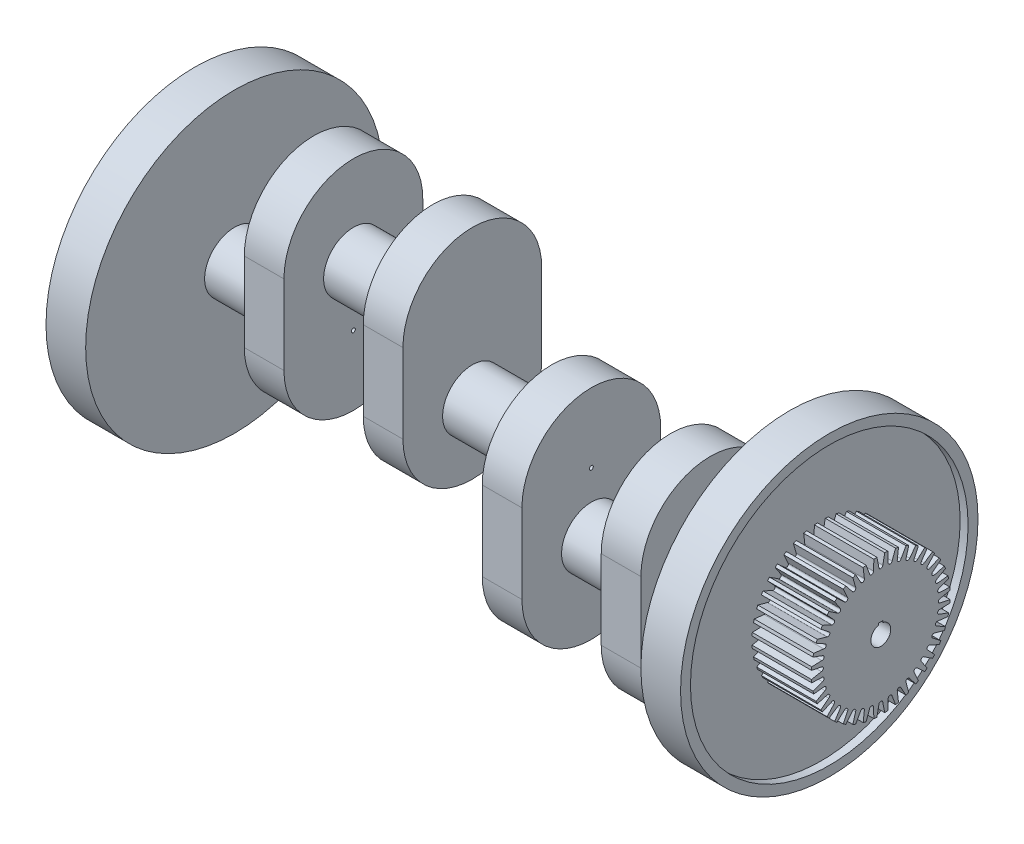
from build123d import *

# Parameters (mm, degrees)
SKETCH1_R            = 37.5
BOSS_EXTRUDE1_DEPTH  = 10
BOSS_EXTRUDE2_START  = 10
SKETCH3_R            = 7.5
BOSS_EXTRUDE2_DEPTH  = 20
BOSS_EXTRUDE3_START  = 20
BOSS_EXTRUDE3_DEPTH  = 10
BOSS_EXTRUDE5_START  = 20
BOSS_EXTRUDE5_DEPTH  = 10
BOSS_EXTRUDE6_START  = 20
BOSS_EXTRUDE6_DEPTH  = 10
BOSS_EXTRUDE7_START  = 20
BOSS_EXTRUDE7_DEPTH  = 10
BOSS_EXTRUDE13_REACH = 89.821
SKETCH14_R           = 7.5
SKETCH15_R           = 7.5
BOSS_EXTRUDE14_DEPTH = 20
SKETCH16_R           = 37.5
BOSS_EXTRUDE15_DEPTH = 10
BOSS_EXTRUDE16_REACH = 115.192
SKETCH12_R           = 7.5
BOSS_EXTRUDE17_REACH = 133.196
SKETCH11_R           = 7.5
SKETCH21_R           = 35
CUT_EXTRUDE3_DEPTH   = 2
SKETCH22_R           = 35
CUT_EXTRUDE4_DEPTH   = 2
SKETCH23_R           = 17.5
BOSS_EXTRUDE18_DEPTH = 15
SKETCH24_R           = 0.5
CUT_EXTRUDE5_DEPTH   = 180.034912796
SKETCH27_R           = 2.5
CUT_EXTRUDE6_DEPTH   = 53
SKETCH32_W           = 1.17994976
SKETCH32_H           = 0.75
CUT_EXTRUDE9_DEPTH   = 132.196417634
CUT_EXTRUDE11_DEPTH  = 15
CIRPATTERN1_COUNT    = 40
SKETCH34_R           = 5
SKETCH34_R_2         = 3.75
BOSS_EXTRUDE19_DEPTH = 2
CUT_EXTRUDE13_DEPTH  = 2
CIRPATTERN2_DEPTH    = 2


# Read off the part's stored shape, not the designer's step: CirPattern2
with BuildPart() as part:
    # Sketch1 → Boss-Extrude1 (new body)
    with BuildSketch(Plane(origin=(0, 0, 0), x_dir=(0, 0, -1), z_dir=(1, 0, 0))):
        Circle(SKETCH1_R)
    extrude(amount=BOSS_EXTRUDE1_DEPTH)

    # Sketch3 → Boss-Extrude2 (add)
    with BuildSketch(Plane(origin=(0, 0, 0), x_dir=(0, 0, -1), z_dir=(1, 0, 0)).offset(BOSS_EXTRUDE2_START)):
        Circle(SKETCH3_R)
    extrude(amount=BOSS_EXTRUDE2_DEPTH)

    # Sketch4 → Boss-Extrude3 (add)
    with BuildSketch(Plane(origin=(10, 0, 0), x_dir=(0, 0, -1), z_dir=(1, 0, 0)).offset(BOSS_EXTRUDE3_START)):
        with BuildLine():
            Line((-17.5, 0), (-17.5, 20))
            ThreePointArc((-17.5, 20), (0, 37.5), (17.5, 20))
            Line((17.5, 20), (17.5, 0))
            ThreePointArc((17.5, 0), (0, -17.5), (-17.5, 0))
        make_face()
    extrude(amount=BOSS_EXTRUDE3_DEPTH)


with BuildPart() as body_2:
    # Sketch7 → Boss-Extrude5 (new body)
    with BuildSketch(Plane(origin=(40, 0, 0), x_dir=(0, 0, -1), z_dir=(1, 0, 0)).offset(BOSS_EXTRUDE5_START)):
        with BuildLine():
            Line((-17.5, 0), (-17.5, 20))
            ThreePointArc((-17.5, 20), (0, 37.5), (17.5, 20))
            Line((17.5, 20), (17.5, 0))
            ThreePointArc((17.5, 0), (0, -17.5), (-17.5, 0))
        make_face()
    extrude(amount=BOSS_EXTRUDE5_DEPTH)


with BuildPart() as body_3:
    # Sketch8 → Boss-Extrude6 (new body)
    with BuildSketch(Plane(origin=(70, 0, 0), x_dir=(0, 0, -1), z_dir=(1, 0, 0)).offset(BOSS_EXTRUDE6_START)):
        with BuildLine():
            Line((17.5, 0), (17.5, -20))
            ThreePointArc((17.5, -20), (0, -37.5), (-17.5, -20))
            Line((-17.5, -20), (-17.5, 0))
            ThreePointArc((-17.5, 0), (0, 17.5), (17.5, 0))
        make_face()
    extrude(amount=BOSS_EXTRUDE6_DEPTH)

    # Sketch14 → Boss-Extrude13 (add, up to next)
    with BuildSketch(Plane(origin=(70, 0, 0), x_dir=(0, 0, -1), z_dir=(1, 0, 0)), mode=Mode.PRIVATE) as boss_extrude13_sk1:
        Circle(SKETCH14_R)
    boss_extrude13_tool1 = extrude(boss_extrude13_sk1.sketch, amount=BOSS_EXTRUDE13_REACH, mode=Mode.PRIVATE) - body_3.part

    add(body_2.part)  # Boss-Extrude13 merges body 2
    add(boss_extrude13_tool1.solids().sort_by_distance((70, 0, 0))[0])


with BuildPart() as body_4:
    # Sketch9 → Boss-Extrude7 (new body)
    with BuildSketch(Plane(origin=(100, 0, 0), x_dir=(0, 0, -1), z_dir=(1, 0, 0)).offset(BOSS_EXTRUDE7_START)):
        with BuildLine():
            Line((17.5, 0), (17.5, -20))
            ThreePointArc((17.5, -20), (0, -37.5), (-17.5, -20))
            Line((-17.5, -20), (-17.5, 0))
            ThreePointArc((-17.5, 0), (0, 17.5), (17.5, 0))
        make_face()
    extrude(amount=BOSS_EXTRUDE7_DEPTH)

    # Sketch15 → Boss-Extrude14 (add)
    with BuildSketch(Plane(origin=(130, 0, 0), x_dir=(0, 0, -1), z_dir=(1, 0, 0))):
        Circle(SKETCH15_R)
    extrude(amount=BOSS_EXTRUDE14_DEPTH)

    # Sketch16 → Boss-Extrude15 (add)
    with BuildSketch(Plane(origin=(150, 0, 0), x_dir=(0, 0, -1), z_dir=(1, 0, 0))):
        Circle(SKETCH16_R)
    extrude(amount=BOSS_EXTRUDE15_DEPTH)

    # Sketch12 → Boss-Extrude16 (add, up to next)
    with BuildSketch(Plane(origin=(100, 0, 0), x_dir=(0, 0, -1), z_dir=(1, 0, 0)), mode=Mode.PRIVATE) as boss_extrude16_sk1:
        with Locations((0, -15)):
            Circle(SKETCH12_R)
    boss_extrude16_tool1 = extrude(boss_extrude16_sk1.sketch, amount=BOSS_EXTRUDE16_REACH, mode=Mode.PRIVATE) - body_4.part

    add(body_3.part)  # Boss-Extrude16 merges body 3
    add(boss_extrude16_tool1.solids().sort_by_distance((100, -15, 0))[0])

    # Sketch11 → Boss-Extrude17 (add, up to next)
    with BuildSketch(Plane(origin=(40, 0, 0), x_dir=(0, 0, -1), z_dir=(1, 0, 0)), mode=Mode.PRIVATE) as boss_extrude17_sk1:
        with Locations((0, 15)):
            Circle(SKETCH11_R)
    boss_extrude17_tool1 = extrude(boss_extrude17_sk1.sketch, amount=BOSS_EXTRUDE17_REACH, mode=Mode.PRIVATE) - body_4.part

    add(part.part)  # Boss-Extrude17 merges part
    add(boss_extrude17_tool1.solids().sort_by_distance((40, 15, 0))[0])

    # Sketch21 → Cut-Extrude3 (cut)
    with BuildSketch(Plane(origin=(160, 0, 0), x_dir=(0, 0, -1), z_dir=(1, 0, 0))):
        Circle(SKETCH21_R)
    extrude(amount=-CUT_EXTRUDE3_DEPTH, mode=Mode.SUBTRACT)

    # Sketch22 → Cut-Extrude4 (cut)
    with BuildSketch(Plane.ZY):
        with Locations(Location((0, 0, 0), (0, 0, 180))):
            Circle(SKETCH22_R)
    extrude(amount=-CUT_EXTRUDE4_DEPTH, mode=Mode.SUBTRACT)

    # Sketch23 → Boss-Extrude18 (add)
    with BuildSketch(Plane(origin=(158, 0, 0), x_dir=(0, 0, -1), z_dir=(1, 0, 0))):
        Circle(SKETCH23_R)
    extrude(amount=BOSS_EXTRUDE18_DEPTH)

    # Sketch24 → Cut-Extrude5 (cut, through all)
    with BuildSketch(Plane.ZY.offset(-2)):
        Circle(SKETCH24_R)
    extrude(amount=-CUT_EXTRUDE5_DEPTH, mode=Mode.SUBTRACT)

    # Sketch27 → Cut-Extrude6 (cut)
    with BuildSketch(Plane(origin=(173, 0, 0), x_dir=(0, 0, -1), z_dir=(1, 0, 0))):
        Circle(SKETCH27_R)
    extrude(amount=-CUT_EXTRUDE6_DEPTH, mode=Mode.SUBTRACT)

    # Sketch32 → Cut-Extrude9 (cut, through all)
    with BuildSketch(Plane.ZY.offset(-120)):
        with Locations((0, 2.5)):
            Rectangle(SKETCH32_W, SKETCH32_H)
    extrude(amount=-CUT_EXTRUDE9_DEPTH, mode=Mode.SUBTRACT)

    # Sketch33 → Cut-Extrude11 (cut)
    with BuildSketch(Plane(origin=(173, 0, 0), x_dir=(0, 0, -1), z_dir=(1, 0, 0))):
        with BuildLine():
            Line((1, 17.5), (0.498038073, 15))
            ThreePointArc((0.498038073, 15), (0, 14.501961927), (-0.498038073, 15))
            Line((-0.498038073, 15), (-1, 17.5))
            ThreePointArc((-1, 17.5), (0, 18.5), (1, 17.5))
        make_face()
    cut_extrude11 = extrude(amount=-CUT_EXTRUDE11_DEPTH, mode=Mode.SUBTRACT)

    # CirPattern1: Cut-Extrude11 ×40 about axis
    cirpattern1_axis = Axis((0, 0, 0), (1, 0, 0))
    for i in range(1, CIRPATTERN1_COUNT):
        add(cut_extrude11.rotate(cirpattern1_axis, i * 360 / CIRPATTERN1_COUNT), mode=Mode.SUBTRACT)

    # Sketch34 → Boss-Extrude19 (add)
    with BuildSketch(Plane.ZY.offset(-2)):
        Circle(SKETCH34_R)
        Circle(SKETCH34_R_2, mode=Mode.SUBTRACT)
    extrude(amount=BOSS_EXTRUDE19_DEPTH)

    # Sketch35 → Cut-Extrude13 (cut)
    with BuildSketch(Plane.ZY):
        Polygon((-0.075, 4.375), (0.075, 4.375), (0.2, 3.549214862), (-0.2, 3.549214862), align=None)
    extrude(amount=-CUT_EXTRUDE13_DEPTH, mode=Mode.SUBTRACT)

    # CirPattern2 outline → CirPattern2 (cut)
    with BuildSketch(Plane.YZ):
        with BuildLine():
            Line((4.327781804, -0.645410456), (4.347360733, -0.496693726))
            Line((4.347360733, -0.496693726), (3.736301754, -0.320233043))
            ThreePointArc((3.736301754, -0.320233043), (3.71791823, -0.48947322), (3.691872769, -0.657704685))
            Line((3.691872769, -0.657704685), (4.327781804, -0.645410456))
        make_face()
        with BuildLine():
            Line((4.327781804, 0.645410456), (3.691872769, 0.657704685))
            ThreePointArc((3.691872769, 0.657704685), (3.71791823, 0.48947322), (3.736301754, 0.320233043))
            Line((3.736301754, 0.320233043), (4.347360733, 0.496693726))
            Line((4.347360733, 0.496693726), (4.327781804, 0.645410456))
        make_face()
        with BuildLine():
            Line((4.206514062, 1.204777759), (3.574440598, 1.133964025))
            ThreePointArc((3.574440598, 1.133964025), (3.622221848, 0.970571419), (3.662538375, 0.805178646))
            Line((3.662538375, 0.805178646), (4.245336918, 1.059888885))
            Line((4.245336918, 1.059888885), (4.206514062, 1.204777759))
        make_face()
        with BuildLine():
            Line((4.013271697, 1.743530982), (3.395848757, 1.590820926))
            ThreePointArc((3.395848757, 1.590820926), (3.464548247, 1.435062871), (3.526107948, 1.276347419))
            Line((3.526107948, 1.276347419), (4.070674212, 1.604949052))
            Line((4.070674212, 1.604949052), (4.013271697, 1.743530982))
        make_face()
        with BuildLine():
            Line((3.751361142, 2.252451905), (3.159153001, 2.020458441))
            ThreePointArc((3.159153001, 2.020458441), (3.247595264, 1.875), (3.329344837, 1.725677534))
            Line((3.329344837, 1.725677534), (3.826361142, 2.122548095))
            Line((3.826361142, 2.122548095), (3.751361142, 2.252451905))
        make_face()
        with BuildLine():
            Line((3.425263757, 2.722832752), (2.868403263, 2.41552535))
            ThreePointArc((2.868403263, 2.41552535), (2.975075026, 2.282855359), (3.075615713, 2.145480828))
            Line((3.075615713, 2.145480828), (3.516577971, 2.603829751))
            Line((3.516577971, 2.603829751), (3.425263757, 2.722832752))
        make_face()
        with BuildLine():
            Line((3.040559159, 3.146625176), (2.52857435, 2.769261952))
            ThreePointArc((2.52857435, 2.769261952), (2.651650429, 2.651650429), (2.769261951, 2.52857435))
            Line((2.769261951, 2.52857435), (3.146625176, 3.040559159))
            Line((3.146625176, 3.040559159), (3.040559159, 3.146625176))
        make_face()
        with BuildLine():
            Line((2.603829751, 3.516577971), (2.145480828, 3.075615713))
            ThreePointArc((2.145480828, 3.075615713), (2.282855359, 2.975075026), (2.41552535, 2.868403263))
            Line((2.41552535, 2.868403263), (2.722832752, 3.425263757))
            Line((2.722832752, 3.425263757), (2.603829751, 3.516577971))
        make_face()
        with BuildLine():
            Line((2.122548095, 3.826361142), (1.725677534, 3.329344838))
            ThreePointArc((1.725677534, 3.329344838), (1.875, 3.247595264), (2.020458441, 3.159153002))
            Line((2.020458441, 3.159153002), (2.252451905, 3.751361142))
            Line((2.252451905, 3.751361142), (2.122548095, 3.826361142))
        make_face()
        with BuildLine():
            Line((1.604949052, 4.070674212), (1.276347419, 3.526107948))
            ThreePointArc((1.276347419, 3.526107948), (1.435062871, 3.464548247), (1.590820926, 3.395848757))
            Line((1.590820926, 3.395848757), (1.743530982, 4.013271697))
            Line((1.743530982, 4.013271697), (1.604949052, 4.070674212))
        make_face()
        with BuildLine():
            Line((1.059888885, 4.245336918), (0.805178646, 3.662538375))
            ThreePointArc((0.805178646, 3.662538375), (0.970571419, 3.622221848), (1.133964025, 3.574440598))
            Line((1.133964025, 3.574440598), (1.204777759, 4.206514062))
            Line((1.204777759, 4.206514062), (1.059888885, 4.245336918))
        make_face()
        with BuildLine():
            Line((0.496693726, 4.347360733), (0.320233043, 3.736301754))
            ThreePointArc((0.320233043, 3.736301754), (0.48947322, 3.71791823), (0.657704685, 3.691872769))
            Line((0.657704685, 3.691872769), (0.645410456, 4.327781804))
            Line((0.645410456, 4.327781804), (0.496693726, 4.347360733))
        make_face()
        with BuildLine():
            Line((-0.075, 4.375), (-0.170191836, 3.746135974))
            ThreePointArc((-0.170191836, 3.746135974), (0, 3.75), (0.170191836, 3.746135974))
            Line((0.170191836, 3.746135974), (0.075, 4.375))
            Line((0.075, 4.375), (-0.075, 4.375))
        make_face()
        with BuildLine():
            Line((-0.645410456, 4.327781804), (-0.657704685, 3.691872769))
            ThreePointArc((-0.657704685, 3.691872769), (-0.48947322, 3.71791823), (-0.320233043, 3.736301754))
            Line((-0.320233043, 3.736301754), (-0.496693726, 4.347360733))
            Line((-0.496693726, 4.347360733), (-0.645410456, 4.327781804))
        make_face()
        with BuildLine():
            Line((-1.204777759, 4.206514062), (-1.133964025, 3.574440598))
            ThreePointArc((-1.133964025, 3.574440598), (-0.970571419, 3.622221848), (-0.805178646, 3.662538375))
            Line((-0.805178646, 3.662538375), (-1.059888885, 4.245336918))
            Line((-1.059888885, 4.245336918), (-1.204777759, 4.206514062))
        make_face()
        with BuildLine():
            Line((-1.743530982, 4.013271697), (-1.590820926, 3.395848757))
            ThreePointArc((-1.590820926, 3.395848757), (-1.435062871, 3.464548247), (-1.276347419, 3.526107949))
            Line((-1.276347419, 3.526107949), (-1.604949052, 4.070674212))
            Line((-1.604949052, 4.070674212), (-1.743530982, 4.013271697))
        make_face()
        with BuildLine():
            Line((-2.252451905, 3.751361142), (-2.020458441, 3.159153002))
            ThreePointArc((-2.020458441, 3.159153002), (-1.875, 3.247595264), (-1.725677534, 3.329344838))
            Line((-1.725677534, 3.329344838), (-2.122548095, 3.826361142))
            Line((-2.122548095, 3.826361142), (-2.252451905, 3.751361142))
        make_face()
        with BuildLine():
            Line((-2.722832752, 3.425263757), (-2.41552535, 2.868403263))
            ThreePointArc((-2.41552535, 2.868403263), (-2.282855359, 2.975075026), (-2.145480828, 3.075615714))
            Line((-2.145480828, 3.075615714), (-2.603829751, 3.516577971))
            Line((-2.603829751, 3.516577971), (-2.722832752, 3.425263757))
        make_face()
        with BuildLine():
            Line((-3.146625176, 3.040559159), (-2.769261952, 2.52857435))
            ThreePointArc((-2.769261952, 2.52857435), (-2.651650429, 2.651650429), (-2.52857435, 2.769261952))
            Line((-2.52857435, 2.769261952), (-3.040559159, 3.146625176))
            Line((-3.040559159, 3.146625176), (-3.146625176, 3.040559159))
        make_face()
        with BuildLine():
            Line((-3.516577971, 2.603829751), (-3.075615714, 2.145480828))
            ThreePointArc((-3.075615714, 2.145480828), (-2.975075026, 2.282855359), (-2.868403263, 2.41552535))
            Line((-2.868403263, 2.41552535), (-3.425263757, 2.722832752))
            Line((-3.425263757, 2.722832752), (-3.516577971, 2.603829751))
        make_face()
        with BuildLine():
            Line((-3.826361142, 2.122548095), (-3.329344838, 1.725677534))
            ThreePointArc((-3.329344838, 1.725677534), (-3.247595264, 1.875), (-3.159153002, 2.020458441))
            Line((-3.159153002, 2.020458441), (-3.751361142, 2.252451905))
            Line((-3.751361142, 2.252451905), (-3.826361142, 2.122548095))
        make_face()
        with BuildLine():
            Line((-4.070674212, 1.604949052), (-3.526107949, 1.276347419))
            ThreePointArc((-3.526107949, 1.276347419), (-3.464548247, 1.435062871), (-3.395848757, 1.590820926))
            Line((-3.395848757, 1.590820926), (-4.013271697, 1.743530982))
            Line((-4.013271697, 1.743530982), (-4.070674212, 1.604949052))
        make_face()
        with BuildLine():
            Line((-4.245336918, 1.059888885), (-3.662538375, 0.805178646))
            ThreePointArc((-3.662538375, 0.805178646), (-3.622221849, 0.970571419), (-3.574440598, 1.133964025))
            Line((-3.574440598, 1.133964025), (-4.206514062, 1.204777759))
            Line((-4.206514062, 1.204777759), (-4.245336918, 1.059888885))
        make_face()
        with BuildLine():
            Line((-4.347360733, 0.496693726), (-3.736301754, 0.320233043))
            ThreePointArc((-3.736301754, 0.320233043), (-3.71791823, 0.489473221), (-3.69187277, 0.657704685))
            Line((-3.69187277, 0.657704685), (-4.327781804, 0.645410456))
            Line((-4.327781804, 0.645410456), (-4.347360733, 0.496693726))
        make_face()
        with BuildLine():
            Line((-4.375, -0.075), (-3.746135974, -0.170191836))
            ThreePointArc((-3.746135974, -0.170191836), (-3.75, 0), (-3.746135974, 0.170191836))
            Line((-3.746135974, 0.170191836), (-4.375, 0.075))
            Line((-4.375, 0.075), (-4.375, -0.075))
        make_face()
        with BuildLine():
            Line((-4.327781804, -0.645410456), (-3.69187277, -0.657704685))
            ThreePointArc((-3.69187277, -0.657704685), (-3.71791823, -0.489473221), (-3.736301754, -0.320233043))
            Line((-3.736301754, -0.320233043), (-4.347360733, -0.496693726))
            Line((-4.347360733, -0.496693726), (-4.327781804, -0.645410456))
        make_face()
        with BuildLine():
            Line((-4.206514062, -1.204777759), (-3.574440598, -1.133964025))
            ThreePointArc((-3.574440598, -1.133964025), (-3.622221849, -0.970571419), (-3.662538375, -0.805178646))
            Line((-3.662538375, -0.805178646), (-4.245336918, -1.059888885))
            Line((-4.245336918, -1.059888885), (-4.206514062, -1.204777759))
        make_face()
        with BuildLine():
            Line((-4.013271697, -1.743530982), (-3.395848757, -1.590820926))
            ThreePointArc((-3.395848757, -1.590820926), (-3.464548247, -1.435062871), (-3.526107949, -1.276347419))
            Line((-3.526107949, -1.276347419), (-4.070674212, -1.604949052))
            Line((-4.070674212, -1.604949052), (-4.013271697, -1.743530982))
        make_face()
        with BuildLine():
            Line((-3.751361142, -2.252451905), (-3.159153002, -2.020458441))
            ThreePointArc((-3.159153002, -2.020458441), (-3.247595264, -1.875), (-3.329344838, -1.725677534))
            Line((-3.329344838, -1.725677534), (-3.826361142, -2.122548095))
            Line((-3.826361142, -2.122548095), (-3.751361142, -2.252451905))
        make_face()
        with BuildLine():
            Line((-3.425263757, -2.722832752), (-2.868403263, -2.41552535))
            ThreePointArc((-2.868403263, -2.41552535), (-2.975075026, -2.282855359), (-3.075615714, -2.145480828))
            Line((-3.075615714, -2.145480828), (-3.516577971, -2.603829751))
            Line((-3.516577971, -2.603829751), (-3.425263757, -2.722832752))
        make_face()
        with BuildLine():
            Line((-3.040559159, -3.146625176), (-2.52857435, -2.769261952))
            ThreePointArc((-2.52857435, -2.769261952), (-2.651650429, -2.651650429), (-2.769261952, -2.52857435))
            Line((-2.769261952, -2.52857435), (-3.146625176, -3.040559159))
            Line((-3.146625176, -3.040559159), (-3.040559159, -3.146625176))
        make_face()
        with BuildLine():
            Line((-2.603829751, -3.516577971), (-2.145480828, -3.075615714))
            ThreePointArc((-2.145480828, -3.075615714), (-2.282855359, -2.975075026), (-2.41552535, -2.868403263))
            Line((-2.41552535, -2.868403263), (-2.722832752, -3.425263757))
            Line((-2.722832752, -3.425263757), (-2.603829751, -3.516577971))
        make_face()
        with BuildLine():
            Line((-2.122548095, -3.826361142), (-1.725677534, -3.329344838))
            ThreePointArc((-1.725677534, -3.329344838), (-1.875, -3.247595264), (-2.020458441, -3.159153002))
            Line((-2.020458441, -3.159153002), (-2.252451905, -3.751361142))
            Line((-2.252451905, -3.751361142), (-2.122548095, -3.826361142))
        make_face()
        with BuildLine():
            Line((-1.604949052, -4.070674212), (-1.276347419, -3.526107949))
            ThreePointArc((-1.276347419, -3.526107949), (-1.435062871, -3.464548247), (-1.590820926, -3.395848757))
            Line((-1.590820926, -3.395848757), (-1.743530982, -4.013271697))
            Line((-1.743530982, -4.013271697), (-1.604949052, -4.070674212))
        make_face()
        with BuildLine():
            Line((-1.059888885, -4.245336918), (-0.805178646, -3.662538375))
            ThreePointArc((-0.805178646, -3.662538375), (-0.970571419, -3.622221848), (-1.133964025, -3.574440598))
            Line((-1.133964025, -3.574440598), (-1.204777759, -4.206514062))
            Line((-1.204777759, -4.206514062), (-1.059888885, -4.245336918))
        make_face()
        with BuildLine():
            Line((-0.496693726, -4.347360733), (-0.320233043, -3.736301754))
            ThreePointArc((-0.320233043, -3.736301754), (-0.48947322, -3.71791823), (-0.657704685, -3.691872769))
            Line((-0.657704685, -3.691872769), (-0.645410456, -4.327781804))
            Line((-0.645410456, -4.327781804), (-0.496693726, -4.347360733))
        make_face()
        with BuildLine():
            Line((0.075, -4.375), (0.170191836, -3.746135974))
            ThreePointArc((0.170191836, -3.746135974), (0, -3.75), (-0.170191836, -3.746135974))
            Line((-0.170191836, -3.746135974), (-0.075, -4.375))
            Line((-0.075, -4.375), (0.075, -4.375))
        make_face()
        with BuildLine():
            Line((0.645410456, -4.327781804), (0.657704685, -3.691872769))
            ThreePointArc((0.657704685, -3.691872769), (0.48947322, -3.71791823), (0.320233043, -3.736301754))
            Line((0.320233043, -3.736301754), (0.496693726, -4.347360733))
            Line((0.496693726, -4.347360733), (0.645410456, -4.327781804))
        make_face()
        with BuildLine():
            Line((1.204777759, -4.206514062), (1.133964025, -3.574440598))
            ThreePointArc((1.133964025, -3.574440598), (0.970571419, -3.622221848), (0.805178646, -3.662538375))
            Line((0.805178646, -3.662538375), (1.059888885, -4.245336918))
            Line((1.059888885, -4.245336918), (1.204777759, -4.206514062))
        make_face()
        with BuildLine():
            Line((1.743530982, -4.013271697), (1.590820926, -3.395848757))
            ThreePointArc((1.590820926, -3.395848757), (1.435062871, -3.464548247), (1.276347419, -3.526107948))
            Line((1.276347419, -3.526107948), (1.604949052, -4.070674212))
            Line((1.604949052, -4.070674212), (1.743530982, -4.013271697))
        make_face()
        with BuildLine():
            Line((2.252451905, -3.751361142), (2.020458441, -3.159153002))
            ThreePointArc((2.020458441, -3.159153002), (1.875, -3.247595264), (1.725677534, -3.329344838))
            Line((1.725677534, -3.329344838), (2.122548095, -3.826361142))
            Line((2.122548095, -3.826361142), (2.252451905, -3.751361142))
        make_face()
        with BuildLine():
            Line((2.722832752, -3.425263757), (2.41552535, -2.868403263))
            ThreePointArc((2.41552535, -2.868403263), (2.282855359, -2.975075026), (2.145480828, -3.075615713))
            Line((2.145480828, -3.075615713), (2.603829751, -3.516577971))
            Line((2.603829751, -3.516577971), (2.722832752, -3.425263757))
        make_face()
        with BuildLine():
            Line((3.146625176, -3.040559159), (2.769261951, -2.52857435))
            ThreePointArc((2.769261951, -2.52857435), (2.651650429, -2.651650429), (2.52857435, -2.769261952))
            Line((2.52857435, -2.769261952), (3.040559159, -3.146625176))
            Line((3.040559159, -3.146625176), (3.146625176, -3.040559159))
        make_face()
        with BuildLine():
            Line((3.516577971, -2.603829751), (3.075615713, -2.145480828))
            ThreePointArc((3.075615713, -2.145480828), (2.975075026, -2.282855359), (2.868403263, -2.41552535))
            Line((2.868403263, -2.41552535), (3.425263757, -2.722832752))
            Line((3.425263757, -2.722832752), (3.516577971, -2.603829751))
        make_face()
        with BuildLine():
            Line((3.826361142, -2.122548095), (3.329344837, -1.725677534))
            ThreePointArc((3.329344837, -1.725677534), (3.247595264, -1.875), (3.159153001, -2.020458441))
            Line((3.159153001, -2.020458441), (3.751361142, -2.252451905))
            Line((3.751361142, -2.252451905), (3.826361142, -2.122548095))
        make_face()
        with BuildLine():
            Line((4.070674212, -1.604949052), (3.526107948, -1.276347419))
            ThreePointArc((3.526107948, -1.276347419), (3.464548247, -1.435062871), (3.395848757, -1.590820926))
            Line((3.395848757, -1.590820926), (4.013271697, -1.743530982))
            Line((4.013271697, -1.743530982), (4.070674212, -1.604949052))
        make_face()
        with BuildLine():
            Line((4.245336918, -1.059888885), (3.662538375, -0.805178646))
            ThreePointArc((3.662538375, -0.805178646), (3.622221848, -0.970571419), (3.574440598, -1.133964025))
            Line((3.574440598, -1.133964025), (4.206514062, -1.204777759))
            Line((4.206514062, -1.204777759), (4.245336918, -1.059888885))
        make_face()
    extrude(amount=CIRPATTERN2_DEPTH, mode=Mode.SUBTRACT)


solid = body_4.part
